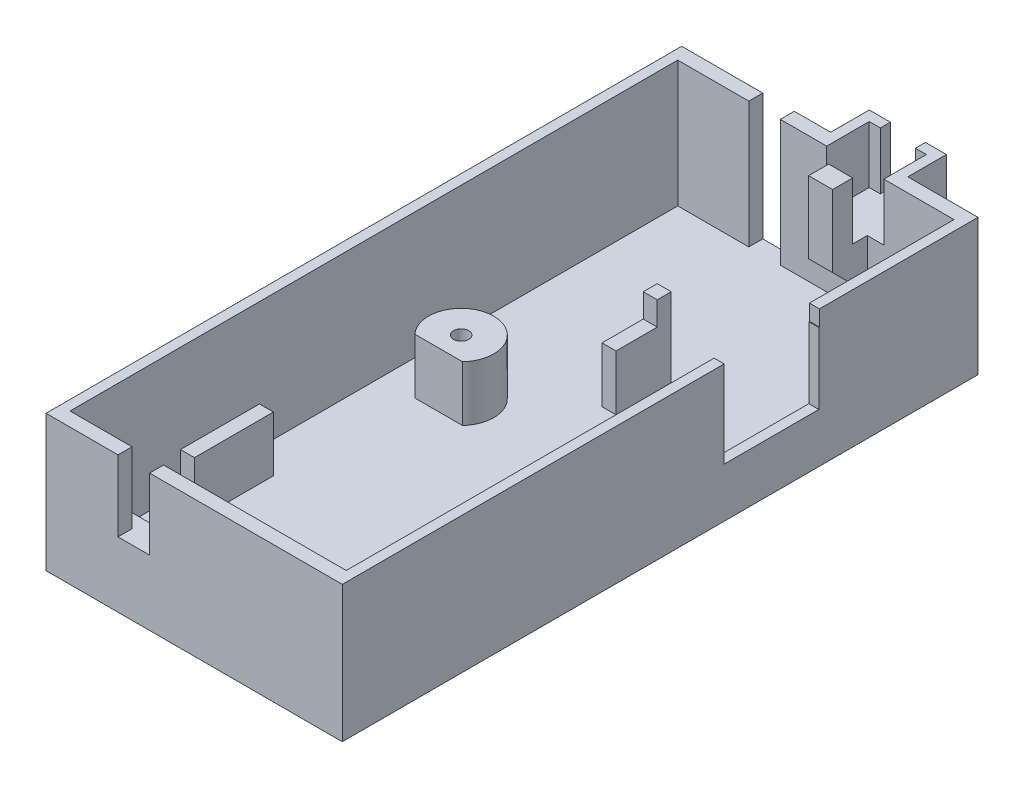
from build123d import *

# Parameters (mm, degrees)
BOSS_EXTRUDE1_DEPTH            = 77
SKETCH3_W                      = 37.54
SKETCH3_H                      = 17.27
BOSS_EXTRUDE2_DEPTH            = 1.77
SKETCH4_W                      = 37.54
SKETCH4_H                      = 17.27
BOSS_EXTRUDE3_DEPTH            = 1.77
SKETCH5_W                      = 4
SKETCH5_H                      = 16
CUT_EXTRUDE2_DEPTH             = 1.77
SKETCH6_W                      = 9.78
SKETCH6_H                      = 11.05
SKETCH6_W_2                    = 7.24
SKETCH6_H_2                    = 7.24
BUTTON_WALLS_DEPTH             = 7.24
SKETCH7_W                      = 9.78
SKETCH7_H                      = 11.05
BUTTON_BOTTOM_DEPTH            = 1.27
SKETCH8_W                      = 7.24
SKETCH8_H                      = 1.77
BUTTON_CUTOUT_MIDDLE_DEPTH     = 7.24
SKETCH9_W                      = 4.45
SKETCH9_H                      = 1.27
SKETCH9_W_2                    = 3.37
SKETCH9_H_2                    = 4.39
BUTTON_CUTOUT_FRONT_BACK_DEPTH = 7.24
SKETCH10_W                     = 3.37
SKETCH10_H                     = 4.39
BUTTON_CUTOUT_BOTTOM_DEPTH     = 1.27
BUTTON_CHAMFER1_SIZE           = 5
SKETCH12_W                     = 35
SKETCH12_H                     = 1.77
SKETCH12_W_2                   = 1.77
SKETCH12_H_2                   = 10
SKETCH12_W_3                   = 7.5
SKETCH12_R                     = 0.9652
SKETCH12_H_3                   = 7
SUPPORT_PCB_BATTERY_DEPTH      = 7
SKETCH13_W                     = 12
SKETCH13_H                     = 9
CUTOUT_USB_DEPTH               = 5
SKETCH14_W                     = 12.076722978
SKETCH14_H                     = 3.837896345
CUTOUT_TEMPORARY_DEPTH         = 5
SKETCH16_W                     = 1.77
SKETCH16_H                     = 1.77
TAB_PCB_RETAINER_DEPTH         = 3
SKETCH17_W                     = 4
SKETCH17_H                     = 1.77
CUTOUT_BACK_MOT_WIRES_DEPTH    = 9


with BuildPart() as part:
    # Sketch2 → Boss-Extrude1 (new body)
    with BuildSketch(Plane.XY):
        Polygon((-30.215355805, 3.088014981), (-30.215355805, -12.911985019), (4.784644195, -12.911985019), (4.784644195, 3.088014981), (6.054644195, 3.088014981), (6.054644195, -14.181985019), (-31.485355805, -14.181985019), (-31.485355805, 3.088014981), align=None)
    extrude(amount=BOSS_EXTRUDE1_DEPTH)

    # Sketch3 → Boss-Extrude2 (add)
    with BuildSketch(Plane.XY.offset(77)):
        with Locations((-12.715355805, -5.546985019)):
            Rectangle(SKETCH3_W, SKETCH3_H)
    extrude(amount=BOSS_EXTRUDE2_DEPTH)

    # Sketch4 → Boss-Extrude3 (add)
    with BuildSketch(Plane(origin=(0, 0, 0), x_dir=(-1, 0, 0), z_dir=(0, 0, -1))):
        with Locations((12.715355805, -5.546985019)):
            Rectangle(SKETCH4_W, SKETCH4_H)
    extrude(amount=BOSS_EXTRUDE3_DEPTH)

    # Sketch5 → Cut-Extrude2 (cut)
    with BuildSketch(Plane(origin=(0, 0, -1.77), x_dir=(-1, 0, 0), z_dir=(0, 0, -1))):
        with Locations((19.215355805, -4.911985019)):
            Rectangle(SKETCH5_W, SKETCH5_H)
    extrude(amount=-CUT_EXTRUDE2_DEPTH, mode=Mode.SUBTRACT)

    # Sketch6 → button_walls (add)
    with BuildSketch(Plane(origin=(0, 3.088014981, 0), x_dir=(1, 0, 0), z_dir=(0, 1, 0))):
        with Locations((-7.725355805, 1.135)):
            Rectangle(SKETCH6_W, SKETCH6_H)
        with Locations((-7.725355805, 1.77)):
            Rectangle(SKETCH6_W_2, SKETCH6_H_2, mode=Mode.SUBTRACT)
    extrude(amount=-BUTTON_WALLS_DEPTH)

    # Sketch7 → button_bottom (add)
    with BuildSketch(Plane.XZ.offset(4.151985019)):
        with Locations((-7.725355805, -1.135)):
            Rectangle(SKETCH7_W, SKETCH7_H)
    extrude(amount=BUTTON_BOTTOM_DEPTH)

    # Sketch8 → button_cutout_middle (cut)
    with BuildSketch(Plane(origin=(0, 3.088014981, 0), x_dir=(1, 0, 0), z_dir=(0, 1, 0))):
        with Locations((-7.725355805, 0.885)):
            Rectangle(SKETCH8_W, SKETCH8_H)
    extrude(amount=-BUTTON_CUTOUT_MIDDLE_DEPTH, mode=Mode.SUBTRACT)

    # Sketch9 → button_cutout_front_back (cut)
    with BuildSketch(Plane(origin=(0, 3.088014981, 0), x_dir=(1, 0, 0), z_dir=(0, 1, 0))):
        with Locations((-7.720355805, 6.025)):
            Rectangle(SKETCH9_W, SKETCH9_H)
        with Locations((-10.930355805, -2.195)):
            Rectangle(SKETCH9_W_2, SKETCH9_H_2)
        with Locations((-4.520355805, -2.195)):
            Rectangle(SKETCH9_W_2, SKETCH9_H_2)
    extrude(amount=-BUTTON_CUTOUT_FRONT_BACK_DEPTH, mode=Mode.SUBTRACT)

    # Sketch10 → button_cutout_bottom (cut)
    with BuildSketch(Plane(origin=(0, -4.151985019, 0), x_dir=(1, 0, 0), z_dir=(0, 1, 0))):
        with Locations((-10.930355805, -2.195)):
            Rectangle(SKETCH10_W, SKETCH10_H)
        with Locations((-4.520355805, -2.195)):
            Rectangle(SKETCH10_W, SKETCH10_H)
    extrude(amount=-BUTTON_CUTOUT_BOTTOM_DEPTH, mode=Mode.SUBTRACT)

    # button_Chamfer1
    # the kernel refuses this chamfer: 5 mm, written as the material it adds along each edge
    with BuildSketch(Plane(origin=(-6.205355805, -5.421985019, 0), x_dir=(0, -0.9996219169112968, -0.027495876610586372), z_dir=(-1, 0, 0))) as button_chamfer1_piece_1_section:
        Polygon((BUTTON_CHAMFER1_SIZE * 0.999621916911, BUTTON_CHAMFER1_SIZE * 0.0274958766106), (-BUTTON_CHAMFER1_SIZE * 0.0274958766106, BUTTON_CHAMFER1_SIZE * 0.999621916911), (0, 0), align=None)
    button_chamfer1_piece_1 = extrude(amount=3.04, mode=Mode.PRIVATE)
    button_chamfer1_piece_1 = split(button_chamfer1_piece_1, bisect_by=Plane(origin=(-7.725355805, -7.110612501, 4.39), z_dir=(0, 0, -1)), keep=Keep.TOP, mode=Mode.PRIVATE)
    add(button_chamfer1_piece_1)

    # Sketch12 → support_pcb_battery (add)
    # profile 1 of 5: a face of its own
    with BuildSketch(Plane(origin=(0, -12.911985019, 0), x_dir=(1, 0, 0), z_dir=(0, 1, 0))):
        with Locations((-12.715355805, -76.115)):
            Rectangle(SKETCH12_W, SKETCH12_H)
    # profile 2 of 5: a face of its own
    with BuildSketch(Plane(origin=(0, -12.911985019, 0), x_dir=(1, 0, 0), z_dir=(0, 1, 0))):
        with Locations((-27.100355805, -60.23)):
            Rectangle(SKETCH12_W_2, SKETCH12_H_2)
    # profile 3 of 5: a face of its own
    with BuildSketch(Plane(origin=(0, -12.911985019, 0), x_dir=(1, 0, 0), z_dir=(0, 1, 0))):
        with Locations((1.034644195, -36.845)):
            Rectangle(SKETCH12_W_3, SKETCH12_H)
    # profile 4 of 5: a face of its own
    with BuildSketch(Plane(origin=(0, -12.911985019, 0), x_dir=(1, 0, 0), z_dir=(0, 1, 0))):
        with BuildLine():
            Line((-25.783918863, -37.73), (-19.764792747, -37.73))
            ThreePointArc((-19.764792747, -37.73), (-22.774355805, -30.7466), (-25.783918863, -37.73))
        make_face()
        with Locations(Location((-22.774355805, -34.8868, 0), (0, 0, 270))):
            Circle(SKETCH12_R, mode=Mode.SUBTRACT)
    # profile 5 of 5: a face of its own
    with BuildSketch(Plane(origin=(0, -12.911985019, 0), x_dir=(1, 0, 0), z_dir=(0, 1, 0))):
        with Locations((-12.100355805, -23.33)):
            Rectangle(SKETCH12_W_2, SKETCH12_H_3)
    extrude(amount=SUPPORT_PCB_BATTERY_DEPTH)

    # Sketch13 → cutout_usb (cut)
    with BuildSketch(Plane(origin=(6.054644195, 0, 0), x_dir=(0, 0, -1), z_dir=(1, 0, 0))):
        with Locations((-24.395224713, -3.411985019)):
            Rectangle(SKETCH13_W, SKETCH13_H)
    extrude(amount=-CUTOUT_USB_DEPTH, mode=Mode.SUBTRACT)

    # Sketch14 → cutout_temporary (cut)
    with BuildSketch(Plane(origin=(6.054644195, 0, 0), x_dir=(0, 0, -1), z_dir=(1, 0, 0))):
        with Locations((-24.356863224, 3.006963154)):
            Rectangle(SKETCH14_W, SKETCH14_H)
    extrude(amount=-CUTOUT_TEMPORARY_DEPTH, mode=Mode.SUBTRACT)

    # Sketch16 → tab_pcb_retainer (add)
    with BuildSketch(Plane(origin=(0, -5.911985019, 0), x_dir=(1, 0, 0), z_dir=(0, 1, 0))):
        with Locations((-12.100355805, -20.715)):
            Rectangle(SKETCH16_W, SKETCH16_H)
    extrude(amount=TAB_PCB_RETAINER_DEPTH)

    # Sketch17 → cutout_back_mot_wires (cut)
    with BuildSketch(Plane(origin=(0, 3.088014981, 0), x_dir=(1, 0, 0), z_dir=(0, 1, 0))):
        with Locations((-20.361355805, -77.885)):
            Rectangle(SKETCH17_W, SKETCH17_H)
    extrude(amount=-CUTOUT_BACK_MOT_WIRES_DEPTH, mode=Mode.SUBTRACT)


solid = part.part
